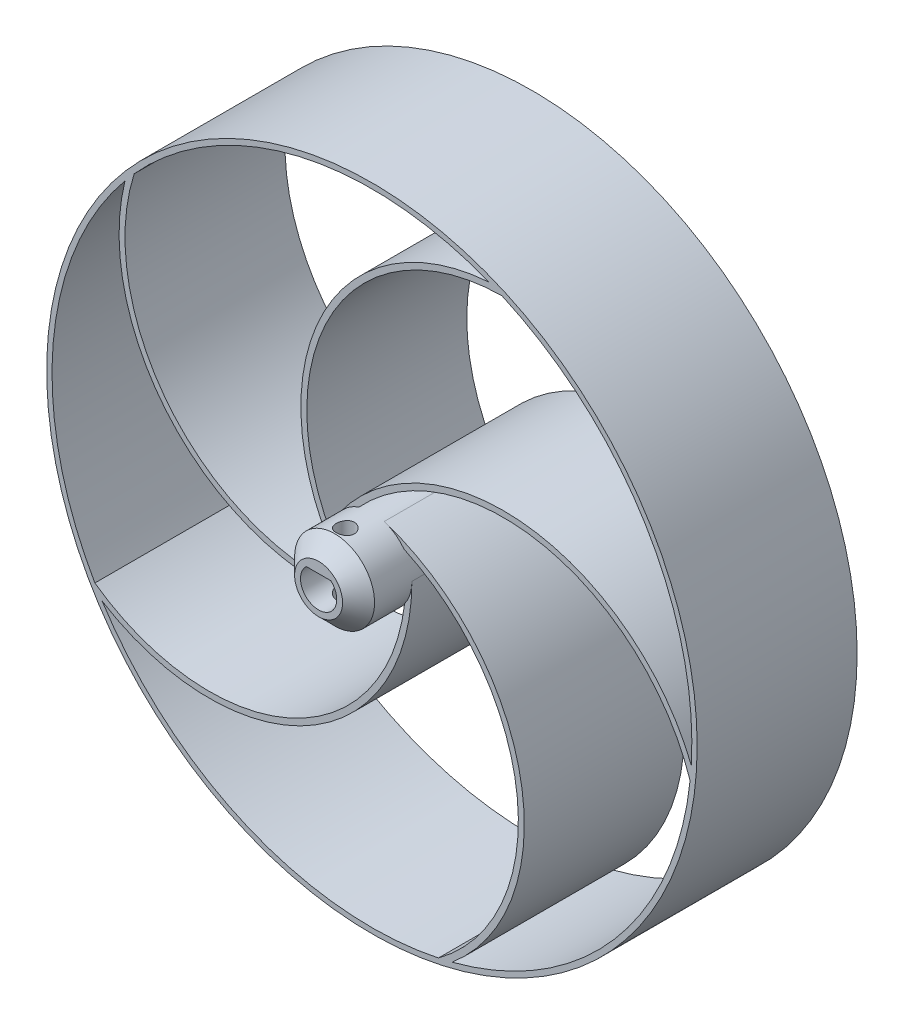
from build123d import *

# Parameters (mm, degrees)
SKETCH1_R               = 30.5
BOSS_EXTRUDE1_DEPTH     = 15
SKETCH2_R               = 3.75
BOSS_EXTRUDE2_DEPTH     = 5
CUT_EXTRUDE1_DEPTH      = 49.356100959
CUT_EXTRUDE1_DEPTH_BACK = 49.356100959
SKETCH3_R               = 0.85
CHAMFER1_SIZE           = 1.5


with BuildPart() as part:
    # Sketch1 → Boss-Extrude1 (new body)
    with BuildSketch(Plane.XY):
        Circle(SKETCH1_R)
        with BuildLine():
            ThreePointArc((-3.033813729, 2.204194696), (-3.566461936, 1.158813729), (-3.75, 0))
            ThreePointArc((-3.75, 0), (-3.749893137, -0.028310145), (-3.749572552, -0.056618677))
            ThreePointArc((-3.749572552, -0.056618677), (-3.611032972, 18.226813335), (12.201407739, 27.406671618))
            ThreePointArc((12.201407739, 27.406671618), (25.644933357, 15.567189634), (29.944566656, -1.822889958))
            ThreePointArc((29.944566656, -1.822889958), (14.64054629, 9.896179992), (-3.033813729, 2.204194696))
        make_face(mode=Mode.SUBTRACT)
        with BuildLine():
            ThreePointArc((1.158813729, 3.566461936), (-0.028310145, 3.749893137), (-1.212529202, 3.548559276))
            ThreePointArc((-1.212529202, 3.548559276), (16.218859038, 9.066691512), (29.835735979, -3.135101049))
            ThreePointArc((29.835735979, -3.135101049), (22.729997369, -19.579254828), (7.519708613, -29.042279221))
            ThreePointArc((7.519708613, -29.042279221), (13.936004079, -10.865899154), (1.158813729, 3.566461936))
        make_face(mode=Mode.SUBTRACT)
        with BuildLine():
            ThreePointArc((3.75, 0), (3.557611987, 1.185705254), (3.000188293, 2.24974892))
            ThreePointArc((3.000188293, 2.24974892), (13.634839116, -12.623289815), (6.238091175, -29.344270625))
            ThreePointArc((6.238091175, -29.344270625), (-11.597022419, -27.667834592), (-25.297131148, -16.126225712))
            ThreePointArc((-25.297131148, -16.126225712), (-6.027622102, -16.611674988), (3.75, 0))
        make_face(mode=Mode.SUBTRACT)
        with BuildLine():
            ThreePointArc((1.158813729, -3.566461936), (2.227035272, -3.017086989), (3.06674754, -2.158137977))
            ThreePointArc((3.06674754, -2.158137977), (-7.792065033, -16.868313668), (-25.980383608, -15.000655572))
            ThreePointArc((-25.980383608, -15.000655572), (-28.977676824, -7.764936953), (-30, 0))
            ThreePointArc((-30, 0), (-28.236730197, 10.133462774), (-23.15419548, 19.075723621))
            ThreePointArc((-23.15419548, 19.075723621), (-17.661279409, 0.599319401), (1.158813729, -3.566461936))
        make_face(mode=Mode.SUBTRACT)
        with BuildLine():
            ThreePointArc((-3.033813729, -2.204194696), (-2.181228495, -3.05036756), (-1.104834079, -3.583551543))
            ThreePointArc((-1.104834079, -3.583551543), (-18.450600149, 2.198098635), (-22.294851286, 20.073355628))
            ThreePointArc((-22.294851286, 20.073355628), (-6.880556914, 29.200307131), (10.987051359, 27.91567127))
            ThreePointArc((10.987051359, 27.91567127), (-4.887648858, 16.982074748), (-3.033813729, -2.204194696))
        make_face(mode=Mode.SUBTRACT)
        with BuildLine():
            ThreePointArc((1.152171862, 1.25), (0.682388392, -1.557031176), (-1.7, 0))
            ThreePointArc((-1.7, 0), (-1.557031176, 0.682388392), (-1.152171862, 1.25))
            Line((-1.152171862, 1.25), (1.152171862, 1.25))
        make_face(mode=Mode.SUBTRACT)
    extrude(amount=BOSS_EXTRUDE1_DEPTH)

    # Sketch2 → Boss-Extrude2 (add)
    with BuildSketch(Plane.XY.offset(15)):
        Circle(SKETCH2_R)
        with BuildLine():
            Line((-1.152171862, 1.25), (1.152171862, 1.25))
            ThreePointArc((1.152171862, 1.25), (0, -1.7), (-1.152171862, 1.25))
        make_face(mode=Mode.SUBTRACT)
    extrude(amount=BOSS_EXTRUDE2_DEPTH)

    # Sketch3 → Cut-Extrude1 (cut, two sides: drawn at the far end of the back side and taken through both)
    with BuildSketch(Plane.XZ.offset(-1.25).offset(-CUT_EXTRUDE1_DEPTH_BACK)):
        with Locations((0, 17.5)):
            Circle(SKETCH3_R)
    extrude(amount=CUT_EXTRUDE1_DEPTH + CUT_EXTRUDE1_DEPTH_BACK, mode=Mode.SUBTRACT)

    # Chamfer1
    chamfer1_edges = [part.edges().sort_by_distance(p)[0] for p in [
        (-3.75, 0, 20),
    ]]
    chamfer(chamfer1_edges, length=CHAMFER1_SIZE)


solid = part.part
